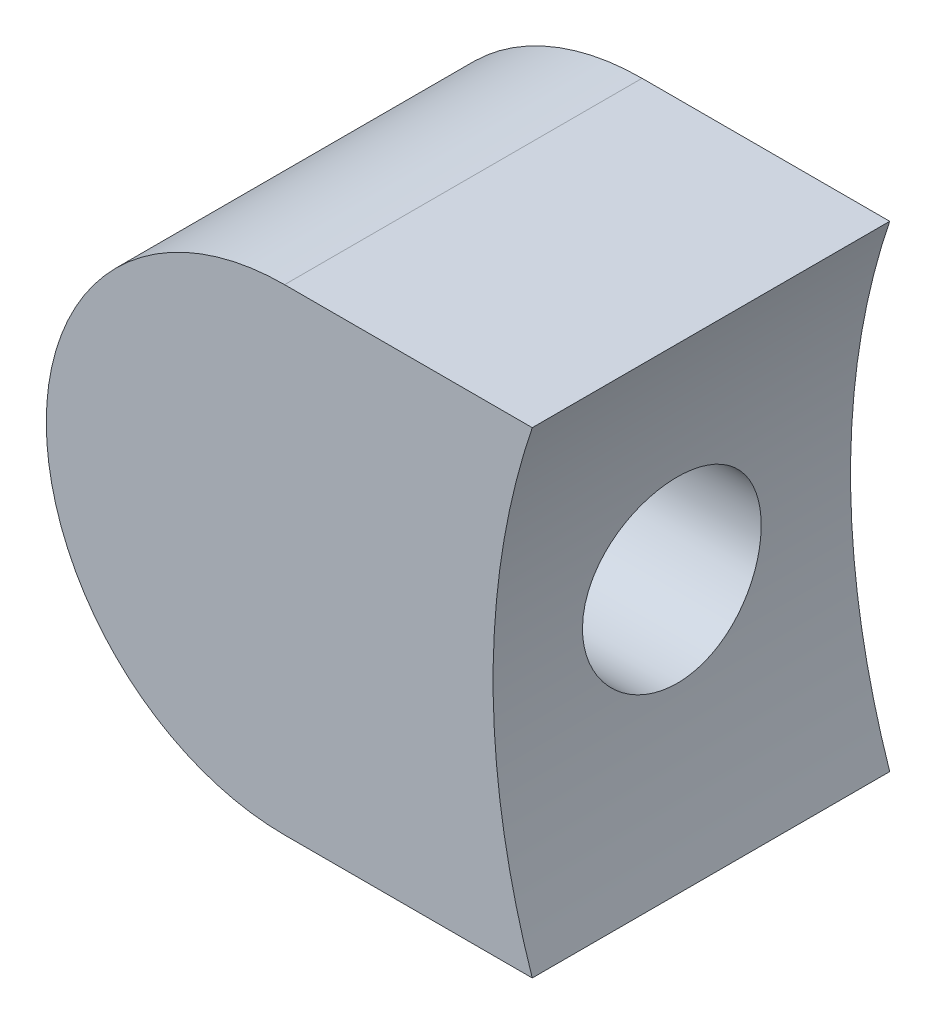
from build123d import *

# Parameters (mm, degrees)
BOSS_EXTRUDE1_DEPTH = 6
SKETCH2_R           = 1.5
CUT_EXTRUDE1_DEPTH  = 10
FILLET1_DEPTH       = 6


with BuildPart() as part:
    # Sketch1 → Boss-Extrude1 (new body)
    with BuildSketch(Plane.XY):
        with BuildLine():
            Line((-11.842719282, 4), (-20, 4))
            Line((-20, 4), (-20, -4))
            Line((-20, -4), (-11.842719282, -4))
            ThreePointArc((-11.842719282, -4), (-12.5, 0), (-11.842719282, 4))
        make_face()
    extrude(amount=BOSS_EXTRUDE1_DEPTH)

    # Sketch2 → Cut-Extrude1 (cut)
    with BuildSketch(Plane.ZY.offset(20)):
        with Locations((3, 0)):
            Circle(SKETCH2_R)
    extrude(amount=-CUT_EXTRUDE1_DEPTH, mode=Mode.SUBTRACT)

    # Fillet1: read off the stored shape, not the designer's step
    # Fillet1 outline → Fillet1 (cut)
    with BuildSketch(Plane.XY):
        with BuildLine():
            Line((-20, -4), (-16, -4))
            ThreePointArc((-16, -4), (-18.828427125, -2.828427125), (-20, 0))
            Line((-20, 0), (-20, -4))
        make_face()
        with BuildLine():
            Line((-20, 4), (-20, 0))
            ThreePointArc((-20, 0), (-18.828427125, 2.828427125), (-16, 4))
            Line((-16, 4), (-20, 4))
        make_face()
    extrude(amount=FILLET1_DEPTH, mode=Mode.SUBTRACT)


solid = part.part
